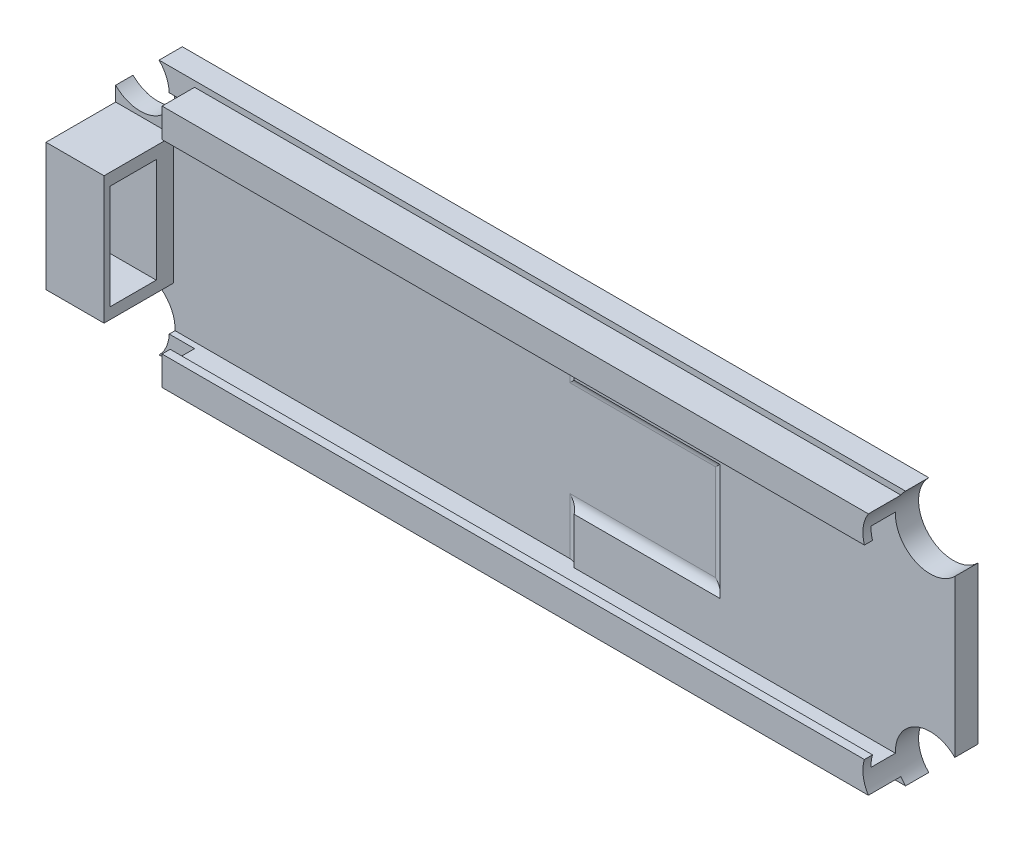
from build123d import *

# Parameters (mm, degrees)
SKIZZE1_W                       = 22
SKIZZE1_H                       = 72.8
AUFSATZ_LINEAR_AUSTRAGEN1_DEPTH = 2
SKIZZE2_R                       = 3
SCHNITT_LINEAR_AUSTRAGEN1_DEPTH = 2
SKIZZE3_W                       = 65.5
SKIZZE3_H                       = 21
AUFSATZ_LINEAR_AUSTRAGEN2_DEPTH = 2.8
SCHNITT_LINEAR_AUSTRAGEN2_DEPTH = 67.590464783
SKIZZE5_R                       = 3
SCHNITT_LINEAR_AUSTRAGEN4_DEPTH = 39.128729326
SKIZZE6_W                       = 18
SKIZZE6_H                       = 1
SCHNITT_LINEAR_AUSTRAGEN5_DEPTH = 40
SKIZZE8_W                       = 15
SKIZZE8_H                       = 10
SCHNITT_LINEAR_AUSTRAGEN6_DEPTH = 0.5
VERRUNDUNG3_R                   = 1
SKIZZE9_W                       = 5
SKIZZE9_H                       = 11
AUFSATZ_LINEAR_AUSTRAGEN3_DEPTH = 6
SKIZZE10_W                      = 9
SKIZZE10_H                      = 4
SCHNITT_LINEAR_AUSTRAGEN7_DEPTH = 75.007364498


with BuildPart() as part:
    # Skizze1 → Aufsatz-Linear austragen1 (new body)
    with BuildSketch(Plane(origin=(0, 0, 0), x_dir=(0, 1, 0), z_dir=(0, 0, 1))):
        Rectangle(SKIZZE1_W, SKIZZE1_H)
    extrude(amount=AUFSATZ_LINEAR_AUSTRAGEN1_DEPTH)

    # Skizze2 → Schnitt-Linear austragen1 (cut)
    with BuildSketch(Plane.XY.offset(2)):
        with Locations((-34.28, 8.88)):
            Circle(SKIZZE2_R)
        with Locations((-34.28, -8.88)):
            Circle(SKIZZE2_R)
        with Locations((34.28, -8.88)):
            Circle(SKIZZE2_R)
        with Locations((34.28, 8.88)):
            Circle(SKIZZE2_R)
    extrude(amount=-SCHNITT_LINEAR_AUSTRAGEN1_DEPTH, mode=Mode.SUBTRACT)

    # Skizze3 → Aufsatz-Linear austragen2 (add)
    with BuildSketch(Plane.XY.offset(2)):
        with Locations((3.65, 0)):
            Rectangle(SKIZZE3_W, SKIZZE3_H)
    extrude(amount=AUFSATZ_LINEAR_AUSTRAGEN2_DEPTH)

    # Skizze4 → Schnitt-Linear austragen2 (cut, through all)
    with BuildSketch(Plane(origin=(-29.1, 0, 0), x_dir=(0, -1, 0), z_dir=(-1, 0, 0))):
        Polygon((-8, 4.8), (8, 4.8), (8, 4.1), (9, 4.1), (9, 2), (-9, 2), (-9, 4.1), (-8, 4.1), align=None)
    extrude(amount=-SCHNITT_LINEAR_AUSTRAGEN2_DEPTH, mode=Mode.SUBTRACT)

    # Skizze5 → Schnitt-Linear austragen4 (cut, through all)
    with BuildSketch(Plane(origin=(0, 0, 2), x_dir=(1, 0, 0), z_dir=(0, 0, -1))):
        with Locations((34.28, -8.88)):
            Circle(SKIZZE5_R)
        with Locations((34.28, 8.88)):
            Circle(SKIZZE5_R)
    extrude(amount=-SCHNITT_LINEAR_AUSTRAGEN4_DEPTH, mode=Mode.SUBTRACT)

    # Skizze6 → Schnitt-Linear austragen5 (cut)
    with BuildSketch(Plane(origin=(-36.4, 0, 0), x_dir=(0, -1, 0), z_dir=(-1, 0, 0))):
        with Locations((0, 2)):
            Rectangle(SKIZZE6_W, SKIZZE6_H)
    extrude(amount=-SCHNITT_LINEAR_AUSTRAGEN5_DEPTH, mode=Mode.SUBTRACT)

    # Skizze8 → Schnitt-Linear austragen6 (cut)
    with BuildSketch(Plane.XY.offset(2)):
        with Locations((8.655984658, -0.007335612)):
            Rectangle(SKIZZE8_W, SKIZZE8_H)
    extrude(amount=-SCHNITT_LINEAR_AUSTRAGEN6_DEPTH, mode=Mode.SUBTRACT)

    # Verrundung3
    # the kernel refuses this fillet: 1 mm, written as the material it adds along each edge
    with BuildSketch(Plane(origin=(3.6, -9, 1.5), x_dir=(0, 0, 1), z_dir=(0, 1, 0))) as verrundung3_piece_1:
        with BuildLine():
            CenterArc((1, -0.866025404), VERRUNDUNG3_R, 120, 60)
            Line((0, -0.866025404), (-0.02, -0.866025404))
            Line((-0.02, -0.866025404), (-0.02, 0))
            Line((-0.02, 0), (0, 0.02))
            ThreePointArc((0, 0.02), (0.25, 0.02), (0.49, 0.017320508))
            Line((0.49, 0.017320508), (0.5, 0))
        make_face()
    extrude(amount=3.992664388)
    with BuildSketch(Plane(origin=(3.6, -5.007335612, 1.5), x_dir=(0, 0, 1), z_dir=(1, 0, 0)), Plane(origin=(16.155984658, 4.992664388, 1.5), x_dir=(0, 0, 1), z_dir=(-1, 0, 0))) as verrundung3_piece_2:
        with BuildLine():
            CenterArc((1, -0.866025404), VERRUNDUNG3_R, 120, 60)
            Line((0, -0.866025404), (-0.02, -0.866025404))
            Line((-0.02, -0.866025404), (-0.02, 0))
            Line((-0.02, 0), (0, 0.02))
            ThreePointArc((0, 0.02), (0.25, 0.02), (0.49, 0.017320508))
            Line((0.49, 0.017320508), (0.5, 0))
        make_face()
    extrude(amount=12.555984658)
    with BuildSketch(Plane(origin=(3.6, 4.992664388, 1.5), x_dir=(0, 0, 1), z_dir=(0, 1, 0))) as verrundung3_piece_3:
        with BuildLine():
            CenterArc((1, -0.866025404), VERRUNDUNG3_R, 120, 60)
            Line((0, -0.866025404), (-0.02, -0.866025404))
            Line((-0.02, -0.866025404), (-0.02, 0))
            Line((-0.02, 0), (0, 0.02))
            ThreePointArc((0, 0.02), (0.25, 0.02), (0.49, 0.017320508))
            Line((0.49, 0.017320508), (0.5, 0))
        make_face()
    extrude(amount=4.007335612)
    with BuildSketch(Plane(origin=(16.155984658, -5.007335612, 1.5), x_dir=(0, 0, 1), z_dir=(0, 1, 0))) as verrundung3_piece_4:
        with BuildLine():
            CenterArc((1, -0.866025404), VERRUNDUNG3_R, 120, 60)
            Line((0, -0.866025404), (-0.02, -0.866025404))
            Line((-0.02, -0.866025404), (-0.02, 0))
            Line((-0.02, 0), (0, 0.02))
            ThreePointArc((0, 0.02), (0.25, 0.02), (0.49, 0.017320508))
            Line((0.49, 0.017320508), (0.5, 0))
        make_face()
    extrude(amount=10)
    with BuildSketch(Plane(origin=(3.6, -9, 1.5), x_dir=(0, 0, 1), z_dir=(0, 1, 0))) as verrundung3_piece_5a_section:
        with BuildLine():
            CenterArc((1, -0.866025404), VERRUNDUNG3_R, 120, 60)
            Line((0, -0.866025404), (-0.02, -0.866025404))
            Line((-0.02, -0.866025404), (-0.02, 0))
            Line((-0.02, 0), (0, 0.02))
            ThreePointArc((0, 0.02), (0.25, 0.02), (0.49, 0.017320508))
            Line((0.49, 0.017320508), (0.5, 0))
        make_face()
    verrundung3_piece_5a = extrude(amount=6.157727897, mode=Mode.PRIVATE)
    verrundung3_piece_5a = split(verrundung3_piece_5a, bisect_by=Plane(origin=(3.383689554, -5.007335612, 1.629516711), z_dir=(0, 1, 0)), keep=Keep.TOP, mode=Mode.PRIVATE)
    with BuildSketch(Plane(origin=(1.434936491, -5.007335612, 1.5), x_dir=(0, 0, 1), z_dir=(1, 0, 0))) as verrundung3_piece_5b_section:
        with BuildLine():
            CenterArc((1, -0.866025404), VERRUNDUNG3_R, 120, 60)
            Line((0, -0.866025404), (-0.02, -0.866025404))
            Line((-0.02, -0.866025404), (-0.02, 0))
            Line((-0.02, 0), (0, 0.02))
            ThreePointArc((0, 0.02), (0.25, 0.02), (0.49, 0.017320508))
            Line((0.49, 0.017320508), (0.5, 0))
        make_face()
    verrundung3_piece_5b = extrude(amount=14.721048168, mode=Mode.PRIVATE)
    verrundung3_piece_5b = split(verrundung3_piece_5b, bisect_by=Plane(origin=(3.6, -4.791025166, 1.629516711), z_dir=(-1, 0, 0)), keep=Keep.TOP, mode=Mode.PRIVATE)
    verrundung3_piece_5 = verrundung3_piece_5a & verrundung3_piece_5b
    add(verrundung3_piece_5)
    with BuildSketch(Plane(origin=(3.6, -5.007335612, 1.5), x_dir=(0, 0, 1), z_dir=(1, 0, 0))) as verrundung3_piece_6a_section:
        with BuildLine():
            CenterArc((1, -0.866025404), VERRUNDUNG3_R, 120, 60)
            Line((0, -0.866025404), (-0.02, -0.866025404))
            Line((-0.02, -0.866025404), (-0.02, 0))
            Line((-0.02, 0), (0, 0.02))
            ThreePointArc((0, 0.02), (0.25, 0.02), (0.49, 0.017320508))
            Line((0.49, 0.017320508), (0.5, 0))
        make_face()
    verrundung3_piece_6a = extrude(amount=14.721048168, mode=Mode.PRIVATE)
    verrundung3_piece_6a = split(verrundung3_piece_6a, bisect_by=Plane(origin=(16.155984658, -4.791025166, 1.629516711), z_dir=(1, 0, 0)), keep=Keep.TOP, mode=Mode.PRIVATE)
    with BuildSketch(Plane(origin=(16.155984658, -7.172399122, 1.5), x_dir=(0, 0, 1), z_dir=(0, 1, 0))) as verrundung3_piece_6b_section:
        with BuildLine():
            CenterArc((1, -0.866025404), VERRUNDUNG3_R, 120, 60)
            Line((0, -0.866025404), (-0.02, -0.866025404))
            Line((-0.02, -0.866025404), (-0.02, 0))
            Line((-0.02, 0), (0, 0.02))
            ThreePointArc((0, 0.02), (0.25, 0.02), (0.49, 0.017320508))
            Line((0.49, 0.017320508), (0.5, 0))
        make_face()
    verrundung3_piece_6b = extrude(amount=12.165063509, mode=Mode.PRIVATE)
    verrundung3_piece_6b = split(verrundung3_piece_6b, bisect_by=Plane(origin=(15.939674213, -5.007335612, 1.629516711), z_dir=(0, -1, 0)), keep=Keep.TOP, mode=Mode.PRIVATE)
    verrundung3_piece_6 = verrundung3_piece_6a & verrundung3_piece_6b
    add(verrundung3_piece_6)
    with BuildSketch(Plane(origin=(16.155984658, 4.992664388, 1.5), x_dir=(0, 0, 1), z_dir=(-1, 0, 0))) as verrundung3_piece_7a_section:
        with BuildLine():
            CenterArc((1, -0.866025404), VERRUNDUNG3_R, 120, 60)
            Line((0, -0.866025404), (-0.02, -0.866025404))
            Line((-0.02, -0.866025404), (-0.02, 0))
            Line((-0.02, 0), (0, 0.02))
            ThreePointArc((0, 0.02), (0.25, 0.02), (0.49, 0.017320508))
            Line((0.49, 0.017320508), (0.5, 0))
        make_face()
    verrundung3_piece_7a = extrude(amount=14.721048168, mode=Mode.PRIVATE)
    verrundung3_piece_7a = split(verrundung3_piece_7a, bisect_by=Plane(origin=(3.6, 4.776353942, 1.629516711), z_dir=(-1, 0, 0)), keep=Keep.TOP, mode=Mode.PRIVATE)
    with BuildSketch(Plane(origin=(3.6, 2.827600878, 1.5), x_dir=(0, 0, 1), z_dir=(0, 1, 0))) as verrundung3_piece_7b_section:
        with BuildLine():
            CenterArc((1, -0.866025404), VERRUNDUNG3_R, 120, 60)
            Line((0, -0.866025404), (-0.02, -0.866025404))
            Line((-0.02, -0.866025404), (-0.02, 0))
            Line((-0.02, 0), (0, 0.02))
            ThreePointArc((0, 0.02), (0.25, 0.02), (0.49, 0.017320508))
            Line((0.49, 0.017320508), (0.5, 0))
        make_face()
    verrundung3_piece_7b = extrude(amount=6.172399122, mode=Mode.PRIVATE)
    verrundung3_piece_7b = split(verrundung3_piece_7b, bisect_by=Plane(origin=(3.383689554, 4.992664388, 1.629516711), z_dir=(0, -1, 0)), keep=Keep.TOP, mode=Mode.PRIVATE)
    verrundung3_piece_7 = verrundung3_piece_7a & verrundung3_piece_7b
    add(verrundung3_piece_7)
    with BuildSketch(Plane(origin=(16.155984658, -5.007335612, 1.5), x_dir=(0, 0, 1), z_dir=(0, 1, 0))) as verrundung3_piece_8a_section:
        with BuildLine():
            CenterArc((1, -0.866025404), VERRUNDUNG3_R, 120, 60)
            Line((0, -0.866025404), (-0.02, -0.866025404))
            Line((-0.02, -0.866025404), (-0.02, 0))
            Line((-0.02, 0), (0, 0.02))
            ThreePointArc((0, 0.02), (0.25, 0.02), (0.49, 0.017320508))
            Line((0.49, 0.017320508), (0.5, 0))
        make_face()
    verrundung3_piece_8a = extrude(amount=12.165063509, mode=Mode.PRIVATE)
    verrundung3_piece_8a = split(verrundung3_piece_8a, bisect_by=Plane(origin=(15.939674213, 4.992664388, 1.629516711), z_dir=(0, 1, 0)), keep=Keep.TOP, mode=Mode.PRIVATE)
    with BuildSketch(Plane(origin=(18.321048168, 4.992664388, 1.5), x_dir=(0, 0, 1), z_dir=(-1, 0, 0))) as verrundung3_piece_8b_section:
        with BuildLine():
            CenterArc((1, -0.866025404), VERRUNDUNG3_R, 120, 60)
            Line((0, -0.866025404), (-0.02, -0.866025404))
            Line((-0.02, -0.866025404), (-0.02, 0))
            Line((-0.02, 0), (0, 0.02))
            ThreePointArc((0, 0.02), (0.25, 0.02), (0.49, 0.017320508))
            Line((0.49, 0.017320508), (0.5, 0))
        make_face()
    verrundung3_piece_8b = extrude(amount=14.721048168, mode=Mode.PRIVATE)
    verrundung3_piece_8b = split(verrundung3_piece_8b, bisect_by=Plane(origin=(16.155984658, 4.776353942, 1.629516711), z_dir=(1, 0, 0)), keep=Keep.TOP, mode=Mode.PRIVATE)
    verrundung3_piece_8 = verrundung3_piece_8a & verrundung3_piece_8b
    add(verrundung3_piece_8)

    # Skizze9 → Aufsatz-Linear austragen3 (add)
    with BuildSketch(Plane.XY.offset(1.5)):
        with Locations((-33.9, 0)):
            Rectangle(SKIZZE9_W, SKIZZE9_H)
    extrude(amount=AUFSATZ_LINEAR_AUSTRAGEN3_DEPTH)

    # Skizze10 → Schnitt-Linear austragen7 (cut, through all)
    with BuildSketch(Plane(origin=(-36.4, 0, 0), x_dir=(0, -1, 0), z_dir=(-1, 0, 0))):
        with Locations((0.038201858, 5)):
            Rectangle(SKIZZE10_W, SKIZZE10_H)
    extrude(amount=-SCHNITT_LINEAR_AUSTRAGEN7_DEPTH, mode=Mode.SUBTRACT)


solid = part.part
